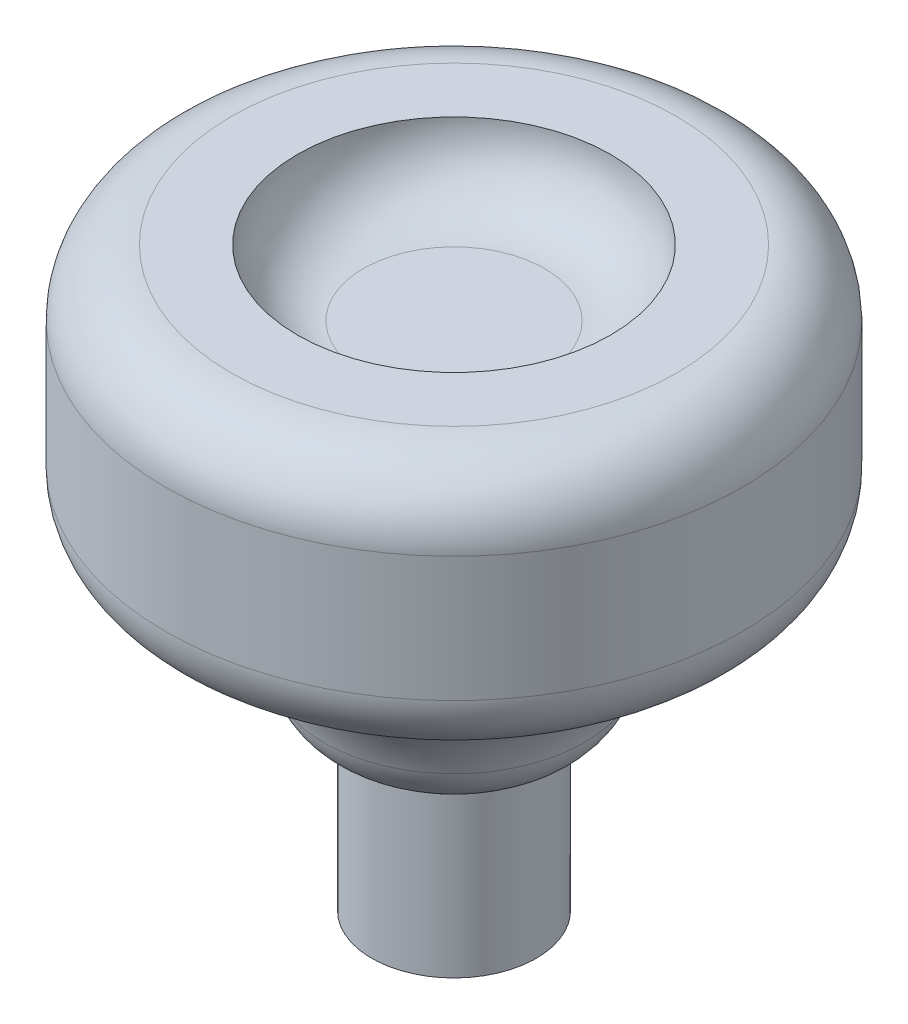
from build123d import *

# Parameters (mm, degrees)
FILLET1_R          = 2.54
SKETCH2_R          = 6.0325
CUT_EXTRUDE1_DEPTH = 2.54
FILLET2_R          = 2.54


# Some blends are built 0.0001 mm under size
with BuildPart() as part:
    # Sketch1 → Base-Revolve (revolve)
    with BuildSketch(Plane.XY, mode=Mode.PRIVATE) as base_revolve_sk:
        with BuildLine():
            ThreePointArc((11.1125, 12.7), (6.622371939, 10.840128061), (4.7625, 6.35))
            Line((4.7625, 6.35), (3.175, 6.35))
            Line((3.175, 6.35), (3.175, 0))
            Line((3.175, 0), (0, 0))
            Line((0, 0), (0, 22.225))
            Line((0, 22.225), (11.1125, 22.225))
            Line((11.1125, 22.225), (11.1125, 12.7))
        make_face()
    revolve(base_revolve_sk.sketch.rotate(Axis((0, 0, 0), (0, 1, 0)), 90), axis=Axis((0, 0, 0), (0, 1, 0)))

    # Fillet1
    # the kernel refuses this fillet: 2.54 mm, written as the material it takes off along each edge
    with BuildSketch(Plane(origin=(0, 6.35, 0), x_dir=(0, 0, -1), z_dir=(1, 0, 0))) as fillet1_piece_1:
        with BuildLine():
            CenterArc((2.57175, 2.467324348), FILLET1_R, 283.739035174, 60.14756783)
            Line((3.175, 0), (3.187065, -0.049346487))
            ThreePointArc((3.187065, -0.049346487), (3.96875, -0.0508), (4.7625, -0.0508))
            Line((4.7625, -0.0508), (4.8133, 0))
            ThreePointArc((4.8133, 0), (4.875473976, 0.882851637), (5.060768571, 1.748275538))
            Line((5.060768571, 1.748275538), (5.011964286, 1.762374534))
        make_face()
    revolve(axis=Axis((0, 6.35, 0), (0, 1, 0)), mode=Mode.SUBTRACT)
    with BuildSketch(Plane(origin=(0, 22.225, 0), x_dir=(0, 0, -1), z_dir=(1, 0, 0))) as fillet1_piece_2:
        with BuildLine():
            CenterArc((11.1125 - FILLET1_R, -FILLET1_R), FILLET1_R, 0, 90)
            Line((11.1125, -FILLET1_R), (11.1125 + FILLET1_R * 0.02, -FILLET1_R))
            Line((11.1125 + FILLET1_R * 0.02, -FILLET1_R), (11.1125 + FILLET1_R * 0.02, FILLET1_R * 0.02))
            Line((11.1125 + FILLET1_R * 0.02, FILLET1_R * 0.02), (11.1125 - FILLET1_R, FILLET1_R * 0.02))
            Line((11.1125 - FILLET1_R, FILLET1_R * 0.02), (11.1125 - FILLET1_R, 0))
        make_face()
    revolve(axis=Axis((0, 22.225, 0), (0, 1, 0)), mode=Mode.SUBTRACT)
    with BuildSketch(Plane(origin=(0, 12.7, 0), x_dir=(0, 0, -1), z_dir=(1, 0, 0))) as fillet1_piece_3:
        with BuildLine():
            CenterArc((8.5725, 2.169418994), FILLET1_R, 286.601549599, 73.398450401)
            Line((11.1125, 2.169418994), (11.1633, 2.169418994))
            Line((11.1633, 2.169418994), (11.1633, 0))
            Line((11.1633, 0), (11.1125, -0.0508))
            ThreePointArc((11.1125, -0.0508), (10.203087128, -0.116791447), (9.312728571, -0.313383113))
            Line((9.312728571, -0.313383113), (9.298214286, -0.264700718))
        make_face()
    revolve(axis=Axis((0, 12.7, 0), (0, 1, 0)), mode=Mode.SUBTRACT)

    # Sketch2 → Cut-Extrude1 (cut)
    with BuildSketch(Plane(origin=(0, 22.225, 0), x_dir=(1, 0, 0), z_dir=(0, 1, 0))):
        with Locations(Location((0, 0, 0), (0, 0, 270))):
            Circle(SKETCH2_R)
    extrude(amount=-CUT_EXTRUDE1_DEPTH, mode=Mode.SUBTRACT)

    # Fillet2
    fillet2_edges = [part.edges().sort_by_distance(p)[0] for p in [
        (0, 19.685, -6.0325),
    ]]
    fillet(fillet2_edges, radius=FILLET2_R - 0.0001)  # a hair under: the kernel refuses the full size


solid = part.part
